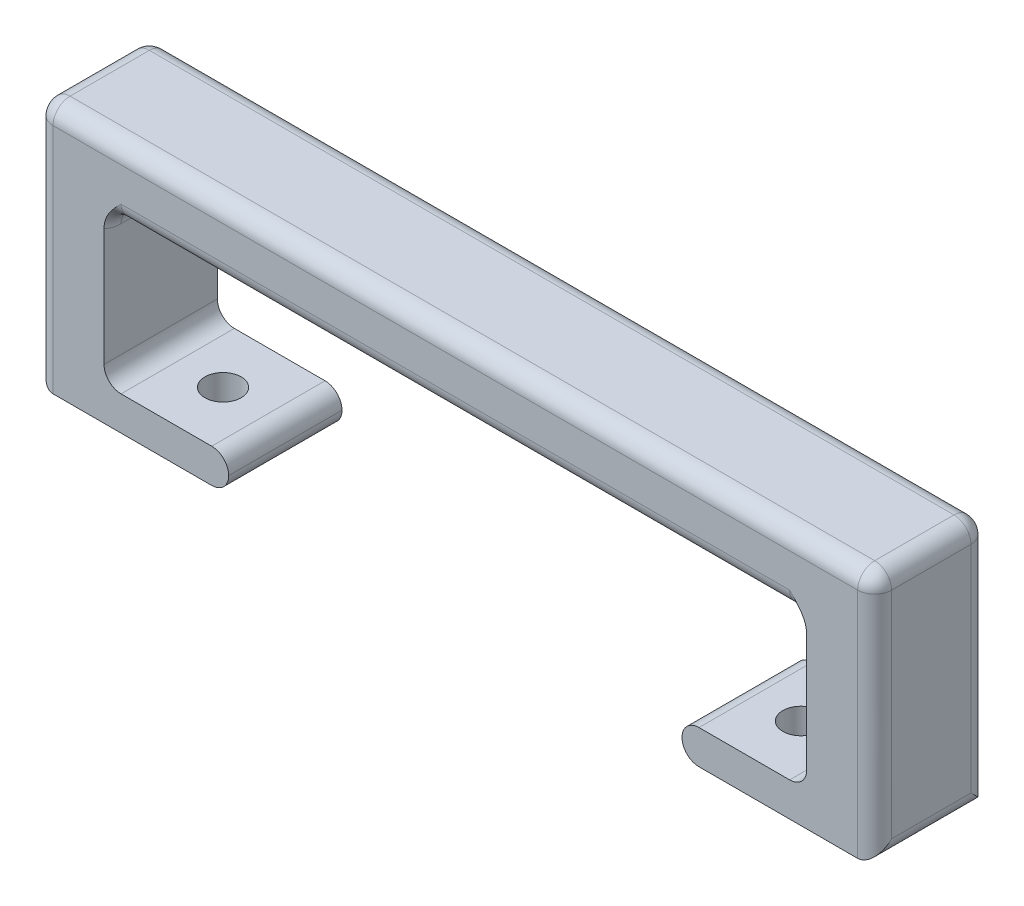
from build123d import *

# Parameters (mm, degrees)
RESSALTO_EXTRUS_O1_DEPTH = 10
CORTE_EXTRUS_O1_REACH    = 44.778
ESBO_O2_R                = 1.6
FILETE1_R                = 1.5
FILETE2_R                = 1.5
FILETE3_R                = 1.5


# Some blends are built 0.0001 mm under size
with BuildPart() as part:
    # Esboço1 → Ressalto-extrusão1 (new body)
    with BuildSketch(Plane.XY):
        Polygon((-37, -3), (-20, -3), (-20, 0), (-31, 0), (-31, 13), (31, 13), (31, 0), (20, 0), (20, -3), (37, -3), (37, 19), (-37, 19), align=None)
    extrude(amount=RESSALTO_EXTRUS_O1_DEPTH)

    # Esboço2 → Corte-extrusão1 (cut, up to next)
    with BuildSketch(Plane(origin=(0, 0, 0), x_dir=(1, 0, 0), z_dir=(0, 1, 0)), mode=Mode.PRIVATE) as corte_extrus_o1_sk1:
        with Locations(Location((-25.5, -5, 0), (0, 0, 180))):
            Circle(ESBO_O2_R)
    corte_extrus_o1_tool1 = extrude(corte_extrus_o1_sk1.sketch, amount=-CORTE_EXTRUS_O1_REACH, mode=Mode.PRIVATE) & part.part
    # Esboço2 → Corte-extrusão1 (cut, up to next)
    with BuildSketch(Plane(origin=(0, 0, 0), x_dir=(1, 0, 0), z_dir=(0, 1, 0)), mode=Mode.PRIVATE) as corte_extrus_o1_sk2:
        with Locations(Location((25.5, -5, 0), (0, 0, 270))):
            Circle(ESBO_O2_R)
    corte_extrus_o1_tool2 = extrude(corte_extrus_o1_sk2.sketch, amount=-CORTE_EXTRUS_O1_REACH, mode=Mode.PRIVATE) & part.part
    add(corte_extrus_o1_tool1.solids().sort_by_distance((-25.5, 0, 5))[0], mode=Mode.SUBTRACT)
    add(corte_extrus_o1_tool2.solids().sort_by_distance((25.5, 0, 5))[0], mode=Mode.SUBTRACT)

    # Filete1
    filete1_edges = [part.edges().sort_by_distance(p)[0] for p in [
        (0, 19, 0),
        (0, 13, 0),
        (0, 13, 10),
        (0, 19, 10),
    ]]
    fillet(filete1_edges, radius=FILETE1_R)

    # Filete2
    filete2_edges = [part.edges().sort_by_distance(p)[0] for p in [
        (37, 7.25, 10),
        (37, 18.560660172, 9.560660172),
        (37, 7.25, 0),
        (37, 18.560660172, 0.439339828),
        (-37, 7.25, 10),
        (-37, 18.560660172, 9.560660172),
        (-37, 7.25, 0),
        (-37, 18.560660172, 0.439339828),
        (37, 19, 5),
        (-37, 19, 5),
        (-20, -3, 5),
        (20, -3, 5),
        (-20, 0, 5),
        (20, 0, 5),
        (31, 0, 5),
        (-31, 0, 5),
        (-37, -3, 5),
        (37, -3, 5),
    ]]
    fillet(filete2_edges, radius=FILETE2_R - 0.0001)  # a hair under: the kernel refuses the full size

    # Filete3
    # the kernel refuses this fillet: 1.5 mm, written as the material it adds along each edge
    with BuildSketch(Plane(origin=(31, 13, 1.5), x_dir=(0, -1, 0), z_dir=(0, 0, 1))) as filete3_piece_1:
        with BuildLine():
            CenterArc((FILETE3_R, -FILETE3_R), FILETE3_R, 90, 90)
            Line((0, -FILETE3_R), (0, 0))
            Line((0, 0), (FILETE3_R, 0))
        make_face()
    extrude(amount=7)
    with BuildSketch(Plane(origin=(-31, 13, 1.5), x_dir=(0, -1, 0), z_dir=(0, 0, 1))) as filete3_piece_2:
        with BuildLine():
            CenterArc((FILETE3_R, FILETE3_R), FILETE3_R, 180, 90)
            Line((0, FILETE3_R), (0, 0))
            Line((0, 0), (FILETE3_R, 0))
        make_face()
    extrude(amount=7)
    with BuildSketch(Plane(origin=(31, 14.5, 8.5), x_dir=(0, 0.5976672776328287, -0.8017442392976475), z_dir=(0, -0.8017442392976475, -0.5976672776328287))) as filete3_piece_3_section:
        with BuildLine():
            CenterArc((1.5 + FILETE3_R, -FILETE3_R), FILETE3_R, 90, 90)
            Line((1.5, -FILETE3_R), (1.5, 0))
            Line((1.5, 0), (1.5 + FILETE3_R, 0))
        make_face()
    filete3_piece_3 = revolve(axis=Axis((31, 14.5, 8.5), (1, 0, 0)), revolution_arc=233.296989237, mode=Mode.PRIVATE)
    filete3_piece_3 = split(filete3_piece_3, bisect_by=Plane(origin=(30.532557549, 13.375091575, 10), z_dir=(0, 0, -1)), keep=Keep.TOP, mode=Mode.PRIVATE)
    add(filete3_piece_3)
    with BuildSketch(Plane(origin=(-31, 14.5, 8.5), x_dir=(0, 0.5976672776328287, -0.8017442392976475), z_dir=(0, -0.8017442392976475, -0.5976672776328287))) as filete3_piece_4_section:
        with BuildLine():
            CenterArc((1.5 + FILETE3_R, FILETE3_R), FILETE3_R, 180, 90)
            Line((1.5, FILETE3_R), (1.5, 0))
            Line((1.5, 0), (1.5 + FILETE3_R, 0))
        make_face()
    filete3_piece_4 = revolve(axis=Axis((-31, 14.5, 8.5), (1, 0, 0)), revolution_arc=233.296989237, mode=Mode.PRIVATE)
    filete3_piece_4 = split(filete3_piece_4, bisect_by=Plane(origin=(-30.532557659, 13.37509149, 10), z_dir=(0, 0, -1)), keep=Keep.TOP, mode=Mode.PRIVATE)
    add(filete3_piece_4)
    with BuildSketch(Plane(origin=(31, 14.5, 1.5), x_dir=(0, 0.5976672776328277, 0.8017442392976482), z_dir=(0, -0.8017442392976482, 0.5976672776328277))) as filete3_piece_5_section:
        with BuildLine():
            CenterArc((1.5 + FILETE3_R, FILETE3_R), FILETE3_R, 180, 90)
            Line((1.5, FILETE3_R), (1.5, 0))
            Line((1.5, 0), (1.5 + FILETE3_R, 0))
        make_face()
    filete3_piece_5 = revolve(axis=Axis((31, 14.5, 1.5), (-1, 0, 0)), revolution_arc=233.296989237, mode=Mode.PRIVATE)
    filete3_piece_5 = split(filete3_piece_5, bisect_by=Plane(origin=(30.532557549, 13.375091575, 0), z_dir=(0, 0, 1)), keep=Keep.TOP, mode=Mode.PRIVATE)
    add(filete3_piece_5)
    with BuildSketch(Plane(origin=(-31, 14.5, 1.5), x_dir=(0, 0.5976672776328277, 0.8017442392976482), z_dir=(0, -0.8017442392976482, 0.5976672776328277))) as filete3_piece_6_section:
        with BuildLine():
            CenterArc((1.5 + FILETE3_R, -FILETE3_R), FILETE3_R, 90, 90)
            Line((1.5, -FILETE3_R), (1.5, 0))
            Line((1.5, 0), (1.5 + FILETE3_R, 0))
        make_face()
    filete3_piece_6 = revolve(axis=Axis((-31, 14.5, 1.5), (-1, 0, 0)), revolution_arc=233.296989237, mode=Mode.PRIVATE)
    filete3_piece_6 = split(filete3_piece_6, bisect_by=Plane(origin=(-30.532557571, 13.375091573, 0), z_dir=(0, 0, 1)), keep=Keep.TOP, mode=Mode.PRIVATE)
    add(filete3_piece_6)


solid = part.part
